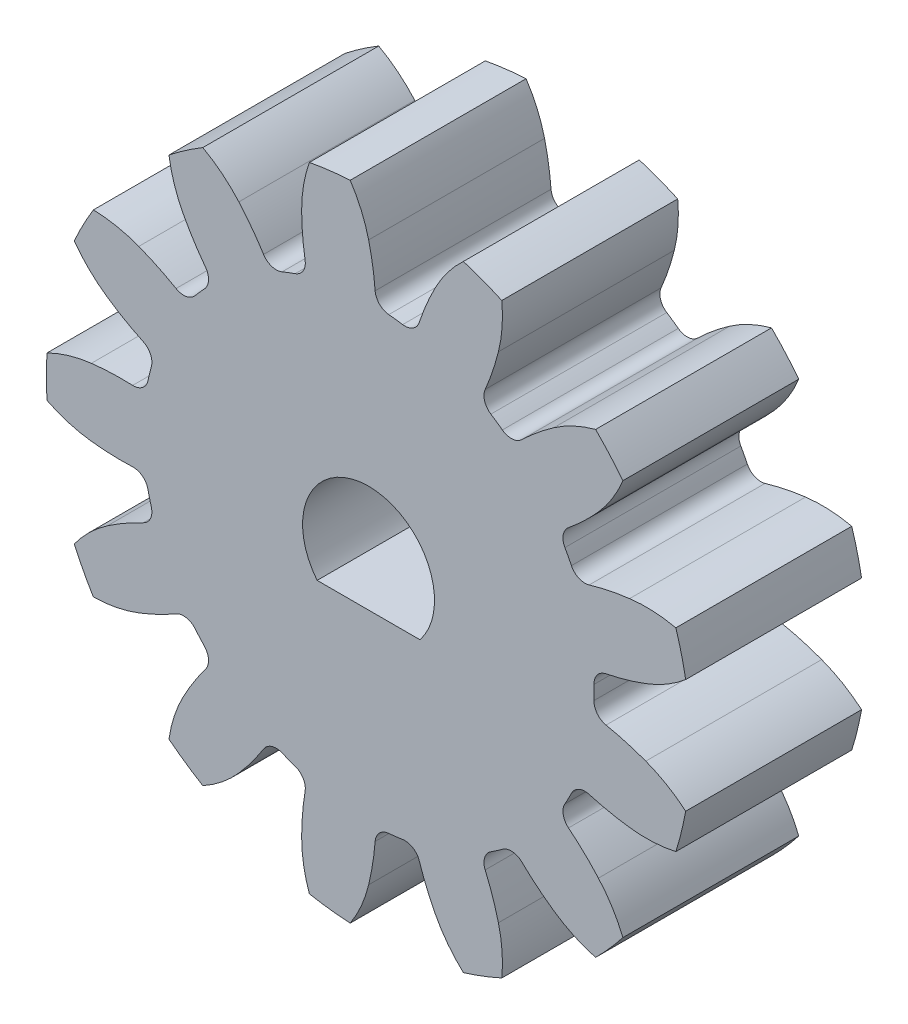
from build123d import *

# Parameters (mm, degrees)
SKETCH1_R                = 7.326923077
BLANK_DISK_DEPTH         = 2.000000064
GEAR_TOOTH_CUT_DEPTH     = 12.107097036
GEAR_TEETH_REVOLVE_COUNT = 13
SKETCH4_R                = 0.75
HUB_EXTRUDE_DEPTH        = 0.635
HEX_BORE_CUT_DEPTH       = 12.099256277
HEX_BORE_CUT_DEPTH_BACK  = 12.099256277


with BuildPart() as part:
    # Sketch1 → BLANK DISK (new, symmetric)
    with BuildSketch(Plane.XY):
        Circle(SKETCH1_R)
    extrude(amount=BLANK_DISK_DEPTH, both=True)

    # Sketch2 → GEAR TOOTH CUT (cut, through all)
    with BuildSketch(Plane.XY.offset(2.000000064)):
        with BuildLine():
            ThreePointArc((-6.69170719, -2.984100644), (-7.114016008, -1.753447463), (-7.311993171, -0.467501495))
            ThreePointArc((-7.311993171, -0.467501495), (-6.820672406, -0.660972702), (-6.303462426, -0.767373077))
            ThreePointArc((-6.303462426, -0.767373077), (-5.834645763, -0.80350314), (-5.364440786, -0.802189535))
            ThreePointArc((-5.364440786, -0.802189535), (-5.140559328, -0.873425337), (-5.015496519, -1.072314102))
            ThreePointArc((-5.015496519, -1.072314102), (-4.979811206, -1.227413224), (-4.939330826, -1.381330469))
            ThreePointArc((-4.939330826, -1.381330469), (-4.957640225, -1.615557309), (-5.122772484, -1.782676381))
            ThreePointArc((-5.122772484, -1.782676381), (-5.539728776, -2.000028389), (-5.938054838, -2.249889939))
            ThreePointArc((-5.938054838, -2.249889939), (-6.346574811, -2.584462254), (-6.69170719, -2.984100644))
        make_face()
    gear_tooth_cut = extrude(amount=-GEAR_TOOTH_CUT_DEPTH, mode=Mode.SUBTRACT)

    # GEAR TEETH REVOLVE: GEAR TOOTH CUT ×13 about axis
    gear_teeth_revolve_axis = Axis((0, 0, 50), (0, 0, -1))
    for i in range(1, GEAR_TEETH_REVOLVE_COUNT):
        add(gear_tooth_cut.rotate(gear_teeth_revolve_axis, i * 360 / GEAR_TEETH_REVOLVE_COUNT), mode=Mode.SUBTRACT)

    # Sketch4 → Hub Extrude (add)
    with BuildSketch(Plane.XY.offset(2.000000064)):
        Circle(SKETCH4_R)
    extrude(amount=HUB_EXTRUDE_DEPTH)

    # Sketch3 → HEX BORE CUT (cut, two sides: drawn at the far end of the back side and taken through both)
    with BuildSketch(Plane.XY.offset(2.000000064).offset(-HEX_BORE_CUT_DEPTH_BACK)):
        with BuildLine():
            Line((-1.168931136, -0.94), (1.168931136, -0.94))
            ThreePointArc((1.168931136, -0.94), (0, 1.5), (-1.168931136, -0.94))
        make_face()
    extrude(amount=HEX_BORE_CUT_DEPTH + HEX_BORE_CUT_DEPTH_BACK, mode=Mode.SUBTRACT)


solid = part.part
